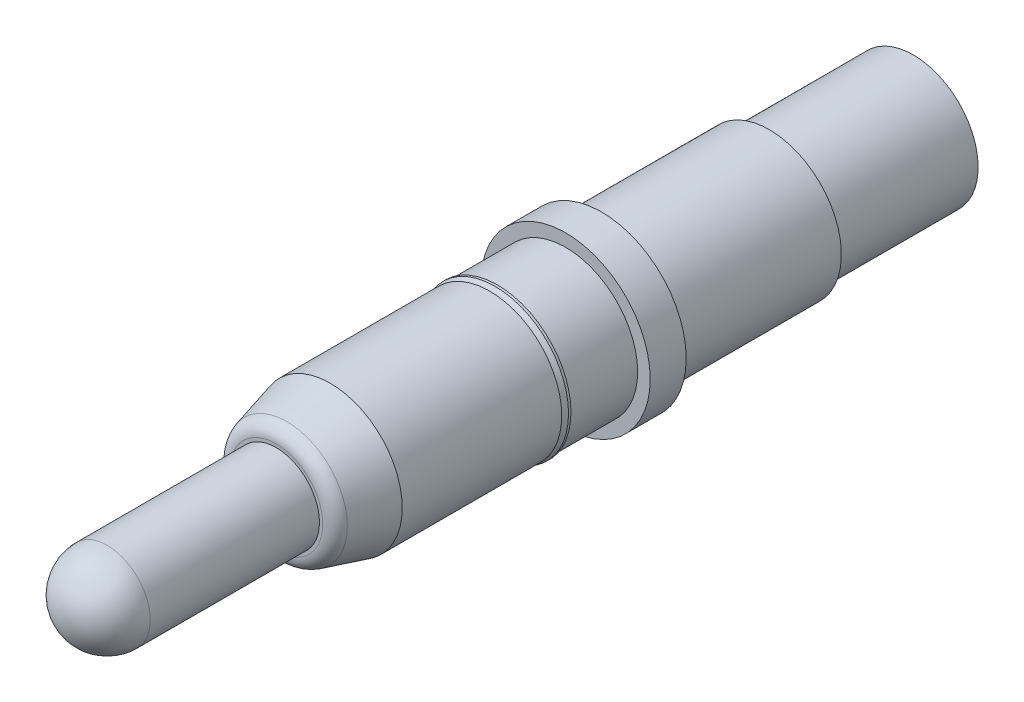
from build123d import *

# Parameters (mm, degrees)
BOSS_EXTRU_2_START = 2.33
ESQUISSE3_R        = 1
BOSS_EXTRU_2_DEPTH = 2.33
ESQUISSE4_R        = 0.9
BOSS_EXTRU_3_DEPTH = 2
ESQUISSE5_W        = 0.6
ESQUISSE5_H        = 4
PER_AGE1_D         = 1.47
PER_AGE1_DEPTH     = 1.6
CHANFREIN1_SIZE    = 0.1
CONG_1_R           = 0.2


# Read off the part's stored shape, not the designer's step: Boss.-Extru.1
with BuildPart() as part:
    # Esquisse1 → Révolution1 (revolve)
    with BuildSketch(Plane(origin=(0, 0, 0), x_dir=(1, 0, 0), z_dir=(0, 1, 0))):
        Polygon((1.175, 0.5), (0, 0.5), (0, -4.02), (0.799038106, -4.02), (1, -3.27), (1, -1.054421399), (1.02, -0.979780383), (1.02, -0.946167323), (1, -0.946167323), (1, 0), (1.175, 0), align=None)
    revolve(axis=Axis((0, 0, -0.5), (0, 0, 1)))

    # Boss.-Extru.1 outline → Boss.-Extru.1 (revolve)
    with BuildSketch(Plane.XZ):
        with BuildLine():
            Line((0.6, 4.02), (0.6, 6.37))
            ThreePointArc((0.6, 6.37), (0.424264069, 6.794264069), (0, 6.97))
            Line((0, 6.97), (0, 4.02))
            Line((0, 4.02), (0.6, 4.02))
        make_face()
    revolve(axis=Axis((0, 0, 0), (0, 0, 1)))

    # Esquisse3 → Boss.-Extru.2 (add)
    with BuildSketch(Plane(origin=(0, 0, -0.5), x_dir=(-1, 0, 0), z_dir=(0, 0, -1)).offset(BOSS_EXTRU_2_START)):
        with Locations(Location((0, 0, 0), (0, 0, 180))):
            Circle(ESQUISSE3_R)
    extrude(amount=-BOSS_EXTRU_2_DEPTH)

    # Esquisse4 → Boss.-Extru.3 (add)
    with BuildSketch(Plane(origin=(0, 0, -2.83), x_dir=(-1, 0, 0), z_dir=(0, 0, -1))):
        Circle(ESQUISSE4_R)
    extrude(amount=BOSS_EXTRU_3_DEPTH)

    # Esquisse5 → Enlèvement de matière-Révolution1 (revolve, cut)
    with BuildSketch(Plane(origin=(0, 0, 0), x_dir=(1, 0, 0), z_dir=(0, 1, 0)), mode=Mode.PRIVATE) as enl_vement_de_mati_re_r_volution1_sk:
        with Locations((0.3, -1.02)):
            Rectangle(ESQUISSE5_W, ESQUISSE5_H)
    revolve(enl_vement_de_mati_re_r_volution1_sk.sketch.rotate(Axis((0, 0, -0.98), (0, 0, 1)), 90), axis=Axis((0, 0, -0.98), (0, 0, 1)), mode=Mode.SUBTRACT)

    # Perçage1
    with Locations(Plane(origin=(0, 0, -4.83), x_dir=(-1, 0, 0), z_dir=(0, 0, -1))):
        with Locations((0, 0)):
            Hole(PER_AGE1_D / 2, depth=PER_AGE1_DEPTH)

    # Chanfrein1
    chanfrein1_edges = [part.edges().sort_by_distance(p)[0] for p in [
        (-0.735, 0, -4.83),
    ]]
    chamfer(chanfrein1_edges, length=CHANFREIN1_SIZE)

    # Congé1
    cong_1_edges = [part.edges().sort_by_distance(p)[0] for p in [
        (-0.799038106, 0, 4.02),
    ]]
    fillet(cong_1_edges, radius=CONG_1_R)


solid = part.part
